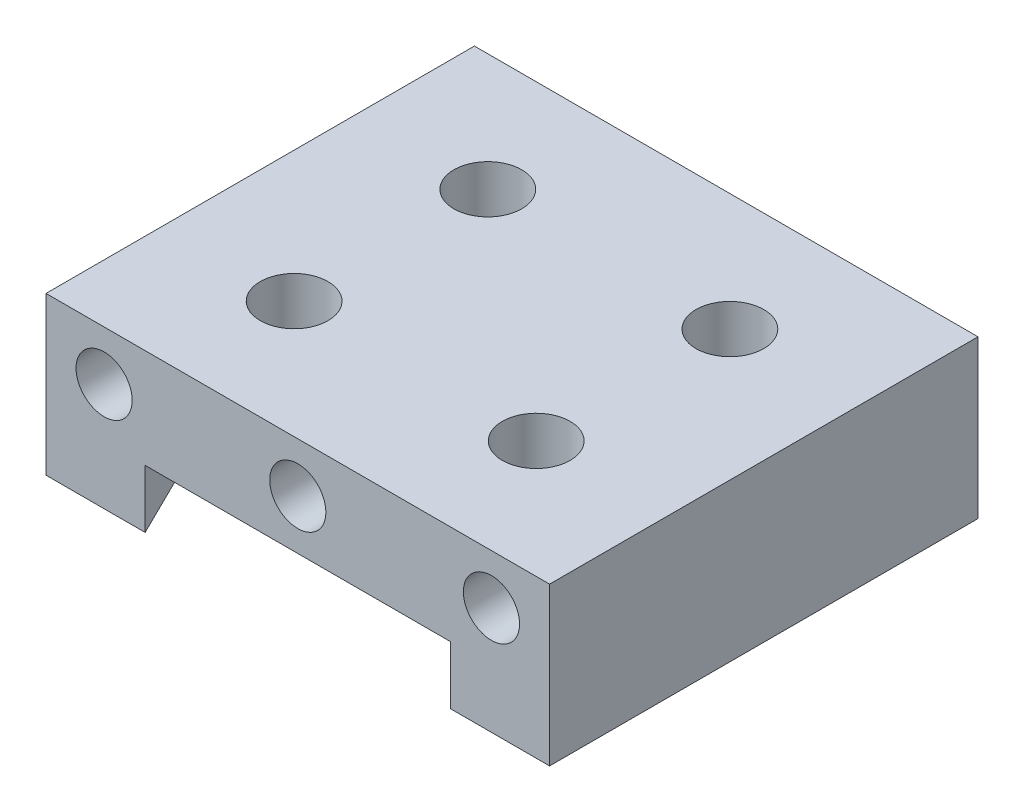
from build123d import *

# Parameters (mm, degrees)
SKETCH1_W           = 26
SKETCH1_H           = 22.12
SKETCH1_R           = 1.75
BOSS_EXTRUDE1_DEPTH = 5.13
CUT_EXTRUDE1_REACH  = 28.165
SKETCH2_R           = 1.45
BOSS_EXTRUDE2_DEPTH = 3


with BuildPart() as part:
    # Sketch1 → Boss-Extrude1 (new body)
    with BuildSketch(Plane(origin=(0, 0, 0), x_dir=(1, 0, 0), z_dir=(0, 1, 0))):
        Rectangle(SKETCH1_W, SKETCH1_H)
        with Locations((-6.25, -5)):
            Circle(SKETCH1_R, mode=Mode.SUBTRACT)
        with Locations((6.25, -5)):
            Circle(SKETCH1_R, mode=Mode.SUBTRACT)
        with Locations((-6.25, 5)):
            Circle(SKETCH1_R, mode=Mode.SUBTRACT)
        with Locations((6.25, 5)):
            Circle(SKETCH1_R, mode=Mode.SUBTRACT)
    extrude(amount=BOSS_EXTRUDE1_DEPTH)

    # Sketch2 → Cut-Extrude1 (cut, up to next)
    with BuildSketch(Plane.XY.offset(11.06), mode=Mode.PRIVATE) as cut_extrude1_sk1:
        with Locations((0, 2.565)):
            Circle(SKETCH2_R)
    cut_extrude1_tool1 = extrude(cut_extrude1_sk1.sketch, amount=-CUT_EXTRUDE1_REACH, mode=Mode.PRIVATE) & part.part
    # Sketch2 → Cut-Extrude1 (cut, up to next)
    with BuildSketch(Plane.XY.offset(11.06), mode=Mode.PRIVATE) as cut_extrude1_sk2:
        with Locations((-10, 2.565)):
            Circle(SKETCH2_R)
    cut_extrude1_tool2 = extrude(cut_extrude1_sk2.sketch, amount=-CUT_EXTRUDE1_REACH, mode=Mode.PRIVATE) & part.part
    # Sketch2 → Cut-Extrude1 (cut, up to next)
    with BuildSketch(Plane.XY.offset(11.06), mode=Mode.PRIVATE) as cut_extrude1_sk3:
        with Locations((10, 2.565)):
            Circle(SKETCH2_R)
    cut_extrude1_tool3 = extrude(cut_extrude1_sk3.sketch, amount=-CUT_EXTRUDE1_REACH, mode=Mode.PRIVATE) & part.part
    add(cut_extrude1_tool1.solids().sort_by_distance((0, 2.565, 11.06))[0], mode=Mode.SUBTRACT)
    add(cut_extrude1_tool2.solids().sort_by_distance((-10, 2.565, 11.06))[0], mode=Mode.SUBTRACT)
    add(cut_extrude1_tool3.solids().sort_by_distance((10, 2.565, 11.06))[0], mode=Mode.SUBTRACT)

    # Sketch3 → Boss-Extrude2 (add)
    with BuildSketch(Plane.XZ):
        with BuildLine():
            Line((-13, -11.06), (-11.035, -11.06))
            Line((-11.035, -11.06), (-11.63, 2.57))
            add(Edge.make_bspline(
                [(-11.63, 2.57), (-11.34945273, 3.758467492), (-10.92, 4.9)],
                knots=[0, 0, 0, 1, 1, 1], degree=2))
            Line((-10.92, 4.9), (-7.881497006, 11.06))
            Line((-7.881497006, 11.06), (-13, 11.06))
            Line((-13, 11.06), (-13, -11.06))
        make_face()
        with BuildLine():
            Line((11.63, 2.57), (11.035, -11.06))
            Line((11.035, -11.06), (13, -11.06))
            Line((13, -11.06), (13, 11.06))
            Line((13, 11.06), (7.881497006, 11.06))
            Line((7.881497006, 11.06), (10.92, 4.9))
            add(Edge.make_bspline(
                [(11.63, 2.57), (11.34945273, 3.758467492), (10.92, 4.9)],
                knots=[0, 0, 0, 1, 1, 1], degree=2))
        make_face()
    extrude(amount=BOSS_EXTRUDE2_DEPTH)


solid = part.part
